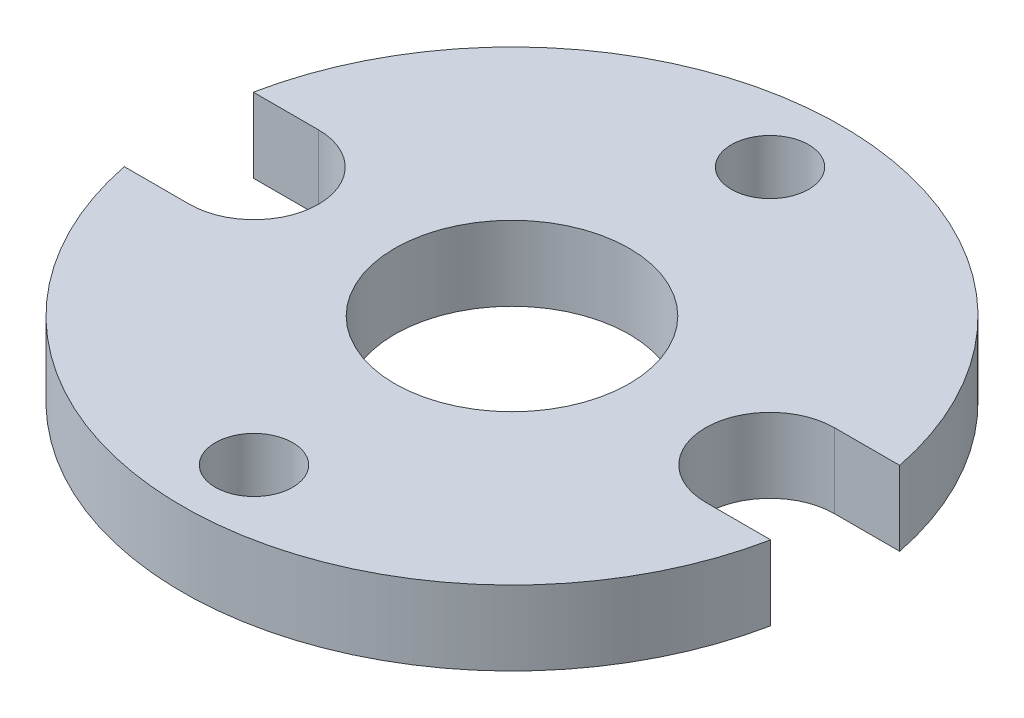
from build123d import *

# Parameters (mm, degrees)
SKETCH1_R           = 5
SKETCH1_R_2         = 1.65
BOSS_EXTRUDE1_DEPTH = 3.175


with BuildPart() as part:
    # Sketch1 → Boss-Extrude1 (new body)
    with BuildSketch(Plane(origin=(0, 0, 0), x_dir=(1, 0, 0), z_dir=(0, 1, 0))):
        with BuildLine():
            Line((-11, 2.75), (-13.77824372, 2.75))
            ThreePointArc((-13.77824372, 2.75), (0, 14.05), (13.77824372, 2.75))
            Line((13.77824372, 2.75), (11, 2.75))
            ThreePointArc((11, 2.75), (8.25, 0), (11, -2.75))
            Line((11, -2.75), (13.77824372, -2.75))
            ThreePointArc((13.77824372, -2.75), (0, -14.05), (-13.77824372, -2.75))
            Line((-13.77824372, -2.75), (-11, -2.75))
            ThreePointArc((-11, -2.75), (-8.25, 0), (-11, 2.75))
        make_face()
        Circle(SKETCH1_R, mode=Mode.SUBTRACT)
        with Locations((0, 11)):
            Circle(SKETCH1_R_2, mode=Mode.SUBTRACT)
        with Locations((0, -11)):
            Circle(SKETCH1_R_2, mode=Mode.SUBTRACT)
    extrude(amount=BOSS_EXTRUDE1_DEPTH)


solid = part.part
